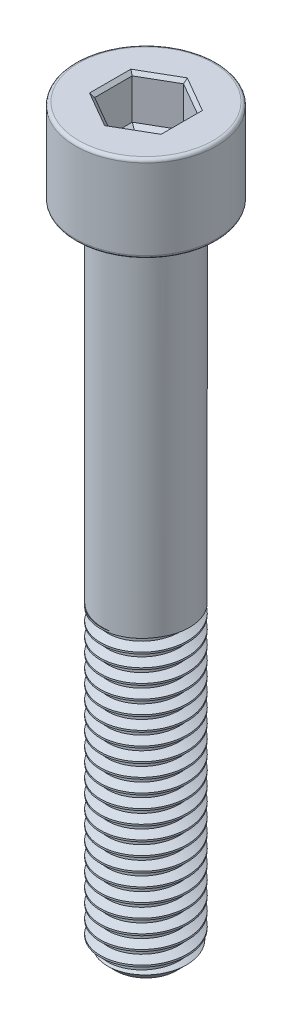
from build123d import *

# Parameters (mm, degrees)
SKETCH1_R           = 4
BOSS_EXTRUDE1_DEPTH = 28
THREAD1_PITCH       = 1.25
SKETCH2_R           = 4
BOSS_EXTRUDE2_DEPTH = 32
SKETCH5_R           = 6.5
BOSS_EXTRUDE3_DEPTH = 8
FILLET1_R           = 0.3
CUT_EXTRUDE1_DEPTH  = 4
CHAMFER1_SIZE       = 0.3
CUT_EXTRUDE2_DEPTH  = 0.4
CUT_EXTRUDE2_DRAFT  = -60


with BuildPart() as part:
    # Sketch1 → Boss-Extrude1 (new body)
    with BuildSketch(Plane(origin=(0, 0, 0), x_dir=(1, 0, 0), z_dir=(0, 1, 0))):
        with Locations(Location((0, 0, 0), (0, 0, 270))):
            Circle(SKETCH1_R)
    extrude(amount=BOSS_EXTRUDE1_DEPTH)

    # Thread1: the profile of Thread Profile1 profile screwed along a right-hand helix of 24 turns, 8 arcs to a turn; built about Z, then put on its axis
    thread1_z = Axis((0, 0, 0), (0, 0, 1))
    thread1_corners = [(4.0003, 0, -0.000173205), (4.0003, 0, 1.093923202), (3.323417656, 0, 0.703124998), (3.323417656, 0, 0.390624998)]
    with BuildLine(mode=Mode.PRIVATE) as thread1_profile:
        Line(thread1_corners[0], thread1_corners[1])
        Line(thread1_corners[1], thread1_corners[2])
        Line(thread1_corners[2], thread1_corners[3])
        Line(thread1_corners[3], thread1_corners[0])
    thread1_cap = Face(thread1_profile.wire())
    thread1_turn_angles = [0, 22.5, 45, 67.5, 90, 112.5, 135, 157.5, 180, 202.5, 225, 247.5, 270, 292.5, 315, 337.5, 360]
    thread1_turn_weights = [1, 0.9238795325112867, 1, 0.9238795325112867, 1, 0.9238795325112867, 1, 0.9238795325112867, 1, 0.9238795325112867, 1, 0.9238795325112867, 1, 0.9238795325112867, 1, 0.9238795325112867, 1]
    thread1_turn_rails = [Edge.make_bspline([Vector(p[0], p[1], 0).rotate(thread1_z, thread1_turn_angles[k]) / thread1_turn_weights[k] + Vector(0, 0, p[2] + THREAD1_PITCH * thread1_turn_angles[k] / 360) for k in range(17)], [0, 0, 0, 1, 1, 2, 2, 3, 3, 4, 4, 5, 5, 6, 6, 7, 7, 8, 8, 8], 2, thread1_turn_weights) for p in thread1_corners]
    thread1_turn_sides = [Face.make_surface_from_curves(thread1_turn_rails[p[0]], thread1_turn_rails[p[1]]) for p in [(0, 1), (1, 2), (2, 3), (3, 0)]]
    thread1 = Plane(origin=(0, 30, 0), x_dir=(-1, 0, 0), z_dir=(0, -1, 0)) * Solid(Shell([*[p.moved(Location((0, 0, THREAD1_PITCH * i))) for i in range(24) for p in thread1_turn_sides], thread1_cap, thread1_cap.rotate(thread1_z, 8640).moved(Location((0, 0, THREAD1_PITCH * 8640 / 360)))]))
    add(thread1, mode=Mode.SUBTRACT)

    # Sketch2 → Boss-Extrude2 (add)
    with BuildSketch(Plane(origin=(0, 28, 0), x_dir=(1, 0, 0), z_dir=(0, 1, 0))):
        with Locations(Location((0, 0, 0), (0, 0, 117.593571361))):
            Circle(SKETCH2_R)
    extrude(amount=BOSS_EXTRUDE2_DEPTH)

    # Sketch5 → Boss-Extrude3 (add)
    with BuildSketch(Plane(origin=(0, 60, 0), x_dir=(1, 0, 0), z_dir=(0, 1, 0))):
        with Locations(Location((0, 0, 0), (0, 0, 270))):
            Circle(SKETCH5_R)
    extrude(amount=BOSS_EXTRUDE3_DEPTH)

    # Sketch6 → Cut-Revolve1 (revolve, cut)
    with BuildSketch(Plane.XY, mode=Mode.PRIVATE) as cut_revolve1_sk:
        Polygon((4.01, 0), (4.01, 1.2), (2.81, 0), align=None)
    revolve(cut_revolve1_sk.sketch.rotate(Axis((0, 0, 0), (0, 1, 0)), 117.593571361), axis=Axis((0, 0, 0), (0, 1, 0)), mode=Mode.SUBTRACT)

    # Fillet1
    fillet1_edges = [part.edges().sort_by_distance(p)[0] for p in [
        (0, 60, -6.5),
        (0, 68, -6.5),
    ]]
    fillet(fillet1_edges, radius=FILLET1_R)

    # Sketch7 → Cut-Extrude1 (cut)
    with BuildSketch(Plane(origin=(0, 68, 0), x_dir=(1, 0, 0), z_dir=(0, 1, 0))):
        Polygon((0, 3.464101615), (-3, 1.732050808), (-3, -1.732050808), (0, -3.464101615), (3, -1.732050808), (3, 1.732050808), align=None)
    extrude(amount=-CUT_EXTRUDE1_DEPTH, mode=Mode.SUBTRACT)

    # Chamfer1
    chamfer1_edges = [part.edges().sort_by_distance(p)[0] for p in [
        (1.5, 68, -2.598076211),
        (-1.5, 68, -2.598076211),
        (-3, 68, 0),
        (-1.5, 68, 2.598076211),
        (1.5, 68, 2.598076211),
        (3, 68, 0),
    ]]
    chamfer(chamfer1_edges, length=CHAMFER1_SIZE)


with BuildPart() as cut_extrude2_tool:
    # Sketch8 → Cut-Extrude2 (with draft: the straight prism first)
    with BuildSketch(Plane(origin=(0, 64, 0), x_dir=(1, 0, 0), z_dir=(0, 1, 0))):
        Polygon((0, 3.464101615), (-3, 1.732050808), (-3, -1.732050808), (0, -3.464101615), (3, -1.732050808), (3, 1.732050808), align=None)
    extrude(amount=-CUT_EXTRUDE2_DEPTH)
    # Cut-Extrude2: the draft: its side faces are tilted about the plane it starts from
    cut_extrude2_sides = [cut_extrude2_tool.faces().sort_by_distance(p)[0] for p in [
        (-1.5, 63.8, -2.598076211),
        (-3, 63.8, 0),
        (-1.5, 63.8, 2.598076211),
        (1.5, 63.8, 2.598076211),
        (3, 63.8, 0),
        (1.5, 63.8, -2.598076211),
    ]]
    draft(cut_extrude2_sides, Plane(origin=(0, 64, 0), x_dir=(1, 0, 0), z_dir=(0, 1, 0)), CUT_EXTRUDE2_DRAFT)


with BuildPart() as part_1:
    add(part.part)

    # Cut-Extrude2: cut by cut_extrude2_tool
    add(cut_extrude2_tool.part, mode=Mode.SUBTRACT)


solid = part_1.part
